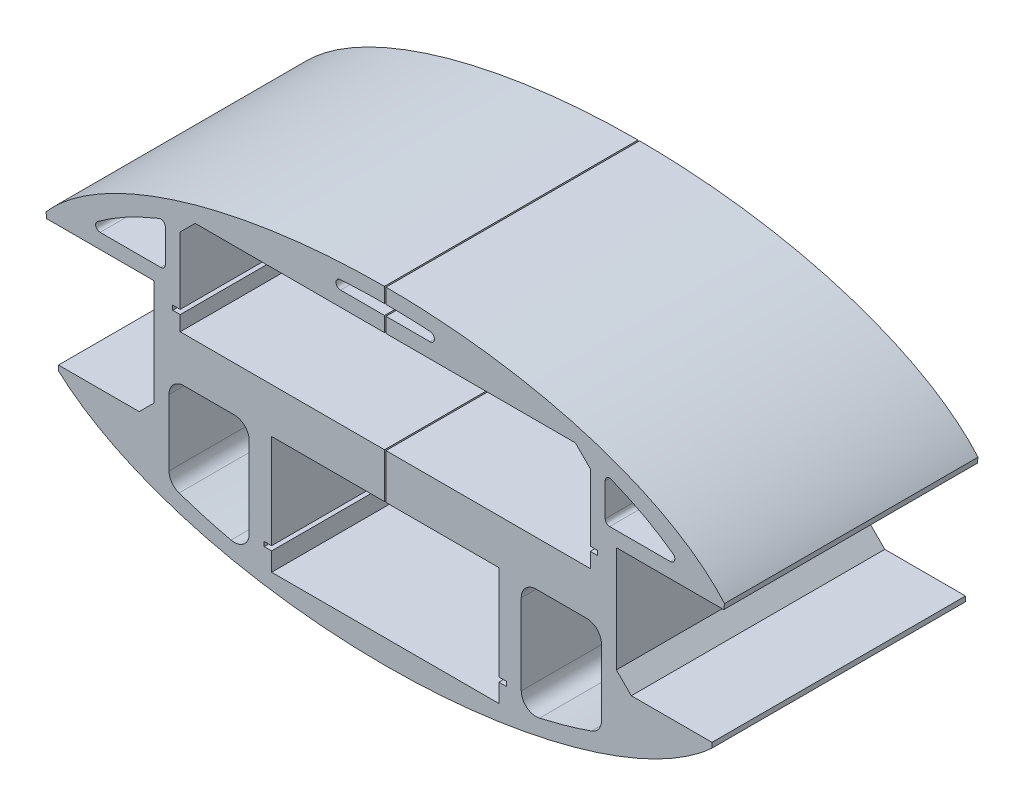
from build123d import *

# Parameters (mm, degrees)
SKETCH1_RX              = 244
SKETCH1_RY              = 110
BOSS_EXTRUDE1_DEPTH     = 170
SKETCH9_W               = 89
SKETCH9_H               = 81
CUT_EXTRUDE4_DEPTH      = 318.074123826
CUT_EXTRUDE5_DEPTH      = 307.853795271
CUT_EXTRUDE6_DEPTH      = 307.853795271
CUT_EXTRUDE6_DEPTH_BACK = 307.853795271
SKETCH11_R              = 6.83635542
SKETCH11_R_2            = 2.75
CHAMFER1_START          = -171
CHAMFER1_DEPTH          = 172
CUT_EXTRUDE7_DEPTH      = 305.55287031
CHAMFER2_SIZE           = 10
CUT_EXTRUDE8_DEPTH      = 305.55287031
CUT_EXTRUDE8_DEPTH_BACK = 305.55287031
SKETCH14_W              = 1
SKETCH14_H              = 125
CUT_EXTRUDE9_DEPTH      = 305.55287044
CUT_EXTRUDE9_DEPTH_BACK = 305.55287044
FILLET1_R               = 10
FILLET2_R               = 3
CHAMFER4_SIZE           = 10


with BuildPart() as part:
    # Sketch1 → Boss-Extrude1 (new body)
    with BuildSketch(Plane.XY):
        with Locations((0, 0)):
            Ellipse(SKETCH1_RX, SKETCH1_RY)
    extrude(amount=-BOSS_EXTRUDE1_DEPTH)

    # Sketch9 → Cut-Extrude4 (cut, through all)
    with BuildSketch(Plane.XY):
        with Locations((199.5, -4.5)):
            Rectangle(SKETCH9_W, SKETCH9_H)
        with Locations((-199.5, -4.5)):
            Rectangle(SKETCH9_W, SKETCH9_H)
    extrude(amount=-CUT_EXTRUDE4_DEPTH, mode=Mode.SUBTRACT)

    # Sketch10 → Cut-Extrude5 (cut, through all)
    with BuildSketch(Plane.XY):
        Polygon((-137.5, 83.1), (137.5, 83.1), (137.5, 28.1), (142.5, 28.1), (142.5, 25.1), (137.5, 25.1), (137.5, 15.1), (-137.5, 15.1), (-137.5, 25.1), (-142.5, 25.1), (-142.5, 28.1), (-137.5, 28.1), align=None)
    extrude(amount=-CUT_EXTRUDE5_DEPTH, mode=Mode.SUBTRACT)

    # Sketch11 → Cut-Extrude6 (cut, two sides: drawn at the far end of the back side and taken through both)
    with BuildSketch(Plane(origin=(0, 0, 0), x_dir=(0, 0, -1), z_dir=(1, 0, 0)).offset(-CUT_EXTRUDE6_DEPTH_BACK)):
        with Locations(Location((60, -2, 0), (0, 0, 270))):
            Circle(SKETCH11_R)
        with Locations(Location((150, -2, 0), (0, 0, 270))):
            Circle(SKETCH11_R_2)
    extrude(amount=CUT_EXTRUDE6_DEPTH + CUT_EXTRUDE6_DEPTH_BACK, mode=Mode.SUBTRACT)

    # Chamfer1: read off the stored shape, not the designer's step
    # Chamfer1 outline → Chamfer1 (cut)
    with BuildSketch(Plane.XY.offset(CHAMFER1_START)):
        with BuildLine():
            add(Edge.make_bspline(
                [(230.562901548, 36), (229.103745792, 37.899303194), (227.491649987, 39.773306403)],
                knots=[0.33341591, 0.33341591, 0.33341591, 0.380657268, 0.380657268, 0.380657268], degree=2, weights=[1, 0.987158133, 0.974806549]))
            Line((227.491649987, 39.773306403), (226.997134148, 36))
            Line((226.997134148, 36), (230.562901548, 36))
        make_face()
        with BuildLine():
            Line((-226.997134148, 36), (-227.491649987, 39.773306403))
            add(Edge.make_bspline(
                [(-227.491649987, 39.773306403), (-229.103745792, 37.899303194), (-230.562901548, 36)],
                knots=[2.760935386, 2.760935386, 2.760935386, 2.808176743, 2.808176743, 2.808176743], degree=2, weights=[0.974806549, 0.987158133, 1]))
            Line((-230.562901548, 36), (-226.997134148, 36))
        make_face()
        with BuildLine():
            add(Edge.make_bspline(
                [(-222.648446162, -45), (-220.94937929, -46.708532895), (-219.122315767, -48.390007394)],
                knots=[3.563050222, 3.563050222, 3.563050222, 3.605462156, 3.605462156, 3.605462156], degree=2, weights=[1, 0.989097384, 0.978597088]))
            Line((-219.122315767, -48.390007394), (-219.112898615, -45))
            Line((-219.112898615, -45), (-222.648446162, -45))
        make_face()
        with BuildLine():
            Line((219.112898615, -45), (219.122315767, -48.390007394))
            add(Edge.make_bspline(
                [(219.122315767, -48.390007394), (220.94937929, -46.708532895), (222.648446162, -45)],
                knots=[5.819315805, 5.819315805, 5.819315805, 5.861727739, 5.861727739, 5.861727739], degree=2, weights=[0.978597088, 0.989097384, 1]))
            Line((222.648446162, -45), (219.112898615, -45))
        make_face()
    extrude(amount=CHAMFER1_DEPTH, mode=Mode.SUBTRACT)

    # Sketch13 → Cut-Extrude7 (cut, through all)
    with BuildSketch(Plane.XY):
        Polygon((-76.2, -81.5), (-76.2, -93.9), (76.2, -93.9), (76.2, -81.5), (81.2, -81.5), (81.2, -78.5), (76.2, -78.5), (76.2, -15), (-76.2, -15), (-76.2, -78.5), (-81.2, -78.5), (-81.2, -81.5), align=None)
    extrude(amount=-CUT_EXTRUDE7_DEPTH, mode=Mode.SUBTRACT)

    # Chamfer2
    chamfer2_edges = [part.edges().sort_by_distance(p)[0] for p in [
        (155, -45, -85),
        (-155, -45, -85),
    ]]
    chamfer(chamfer2_edges, length=CHAMFER2_SIZE)

    # Sketch14 → Cut-Extrude8 (cut, two sides: drawn at the far end of the back side and taken through both)
    with BuildSketch(Plane.XY.offset(-CUT_EXTRUDE8_DEPTH_BACK)):
        with Locations((0, 47.5)):
            Rectangle(SKETCH14_W, SKETCH14_H)
    extrude(amount=CUT_EXTRUDE8_DEPTH + CUT_EXTRUDE8_DEPTH_BACK, mode=Mode.SUBTRACT)

    # Sketch15 → Cut-Extrude9 (cut, two sides: drawn at the far end of the back side and taken through both)
    with BuildSketch(Plane.XY.offset(-CUT_EXTRUDE9_DEPTH_BACK)):
        with BuildLine():
            Line((147.5, 75.514694834), (147.5, 46))
            Line((147.5, 46), (199.781755924, 46))
            add(Edge.make_bspline(
                [(199.781755924, 46), (179.990233789, 62.979001801), (147.5, 75.514694834)],
                knots=[3.619587852, 3.619587852, 3.619587852, 3.997470903, 3.997470903, 3.997470903], degree=2, weights=[1, 0.982203587, 1]))
        make_face()
        with BuildLine():
            Line((91.2, -91.41689608), (91.2, -15))
            Line((91.2, -15), (145, -15))
            Line((145, -15), (145, -76.465113485))
            add(Edge.make_bspline(
                [(91.2, -91.41689608), (120.495747781, -85.643811522), (145, -76.465113485)],
                knots=[1.988139758, 1.988139758, 1.988139758, 2.27109284, 2.27109284, 2.27109284], degree=2, weights=[1, 0.990008876, 1]))
        make_face()
        with BuildLine():
            Line((-82.129314955, 93.1), (82.129314955, 93.1))
            add(Edge.make_bspline(
                [(82.129314955, 93.1), (0, 107.411385607), (-82.129314955, 93.1)],
                knots=[4.338735578, 4.338735578, 4.338735578, 5.086042382, 5.086042382, 5.086042382], degree=2, weights=[1, 0.931, 1]))
        make_face()
        with BuildLine():
            Line((-91.2, -91.41689608), (-91.2, -15))
            Line((-91.2, -15), (-145, -15))
            Line((-145, -15), (-145, -76.465113485))
            add(Edge.make_bspline(
                [(-145, -76.465113485), (-120.495747781, -85.643811522), (-91.2, -91.41689608)],
                knots=[0.870499814, 0.870499814, 0.870499814, 1.153452896, 1.153452896, 1.153452896], degree=2, weights=[1, 0.990008876, 1]))
        make_face()
        with BuildLine():
            Line((-147.5, 75.514694834), (-147.5, 46))
            Line((-147.5, 46), (-199.781755924, 46))
            add(Edge.make_bspline(
                [(-147.5, 75.514694834), (-179.990233789, 62.979001801), (-199.781755924, 46)],
                knots=[5.427307058, 5.427307058, 5.427307058, 5.805190109, 5.805190109, 5.805190109], degree=2, weights=[1, 0.982203587, 1]))
        make_face()
    extrude(amount=CUT_EXTRUDE9_DEPTH + CUT_EXTRUDE9_DEPTH_BACK, mode=Mode.SUBTRACT)

    # Fillet1
    fillet1_edges = [part.edges().sort_by_distance(p)[0] for p in [
        (-145, -15, -85),
        (-145, -76.465113485, -85),
        (-91.2, -91.41689608, -85),
        (145, -76.465113485, -85),
        (91.2, -91.41689608, -85),
        (91.2, -15, -85),
        (-91.2, -15, -85),
        (145, -15, -85),
    ]]
    fillet(fillet1_edges, radius=FILLET1_R)

    # Fillet2
    fillet2_edges = [part.edges().sort_by_distance(p)[0] for p in [
        (-82.129314955, 93.1, -85),
        (82.129314955, 93.1, -85),
        (199.781755924, 46, -85),
        (147.5, 75.514694834, -85),
        (147.5, 46, -85),
        (-147.5, 75.514694834, -85),
        (-147.5, 46, -85),
        (-199.781755924, 46, -85),
    ]]
    fillet(fillet2_edges, radius=FILLET2_R)

    # Chamfer4
    chamfer4_edges = [part.edges().sort_by_distance(p)[0] for p in [
        (-137.5, 83.1, -85),
        (137.5, 83.1, -85),
    ]]
    chamfer(chamfer4_edges, length=CHAMFER4_SIZE)


solid = part.part
